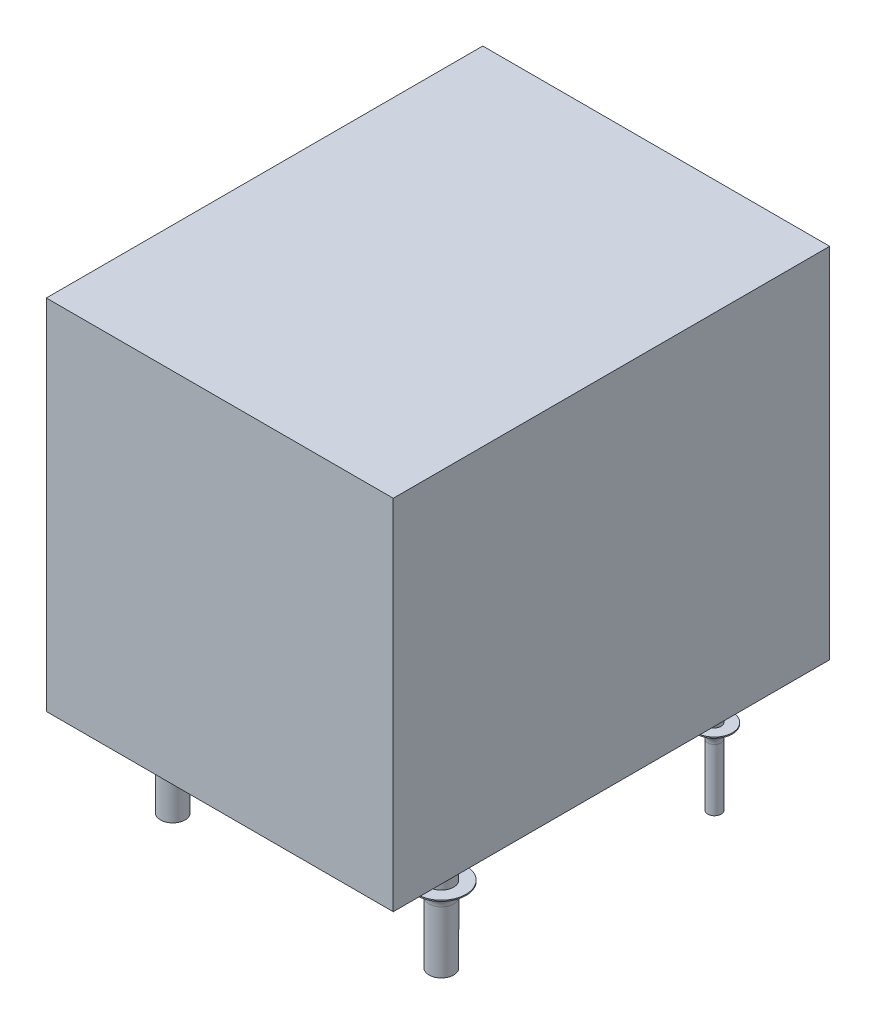
from build123d import *

# Parameters (mm, degrees)
ESQUISSE1_W        = 15.5
ESQUISSE1_H        = 19.5
BOSS_EXTRU_1_DEPTH = 16
ESQUISSE2_R        = 0.55
ESQUISSE2_R_2      = 0.3
BOSS_EXTRU_2_DEPTH = 5
BOSS_EXTRU_3_START = 1.6
ESQUISSE4_R        = 1.1
ESQUISSE4_R_2      = 0.8
BOSS_EXTRU_3_DEPTH = 0.05
CONG_1_R           = 0.6


with BuildPart() as part:
    # Esquisse1 → Boss.-Extru.1 (new body)
    with BuildSketch(Plane(origin=(0, 0, 0), x_dir=(1, 0, 0), z_dir=(0, 1, 0))):
        with Locations((7.75, 9.75)):
            Rectangle(ESQUISSE1_W, ESQUISSE1_H)
    extrude(amount=BOSS_EXTRU_1_DEPTH)

    # Esquisse2 → Boss.-Extru.2 (add)
    with BuildSketch(Plane.XZ):
        with Locations(Location((1.75, -3.9, 0), (0, 0, 270))):
            Circle(ESQUISSE2_R)
        with Locations(Location((13.75, -3.9, 0), (0, 0, 270))):
            Circle(ESQUISSE2_R)
        with Locations(Location((7.75, -18.1, 0), (0, 0, 270))):
            Circle(ESQUISSE2_R)
        with Locations(Location((1.75, -16.1, 0), (0, 0, 270))):
            Circle(ESQUISSE2_R_2)
        with Locations(Location((13.75, -16.1, 0), (0, 0, 270))):
            Circle(ESQUISSE2_R_2)
    extrude(amount=BOSS_EXTRU_2_DEPTH)

    # Esquisse4 → Boss.-Extru.3 (add)
    with BuildSketch(Plane.XZ.offset(BOSS_EXTRU_3_START)):
        with Locations(Location((1.75, -3.9, 0), (0, 0, 270))):
            Circle(ESQUISSE4_R)
        with Locations(Location((13.75, -3.9, 0), (0, 0, 270))):
            Circle(ESQUISSE4_R)
        with Locations(Location((7.75, -18.1, 0), (0, 0, 270))):
            Circle(ESQUISSE4_R)
        with Locations(Location((1.75, -16.1, 0), (0, 0, 270))):
            Circle(ESQUISSE4_R_2)
        with Locations(Location((13.75, -16.1, 0), (0, 0, 270))):
            Circle(ESQUISSE4_R_2)
    extrude(amount=BOSS_EXTRU_3_DEPTH)

    # Congé1
    # the kernel refuses this fillet: 0.6 mm, written as the material it adds along each edge
    with BuildSketch(Plane(origin=(1.75, -1.65, -3.9), x_dir=(0, 0, -1), z_dir=(1, 0, 0))) as cong_1_piece_1:
        with BuildLine():
            CenterArc((1.15, -0.597913037), CONG_1_R, 94.780191847, 85.219808153)
            Line((0.55, -0.597913037), (0.538, -0.597913037))
            Line((0.538, -0.597913037), (0.538, 0))
            Line((0.538, 0), (0.55, 0.012))
            ThreePointArc((0.55, 0.012), (0.825, 0.012), (1.099, 0.011958261))
            Line((1.099, 0.011958261), (1.1, 0))
        make_face()
    revolve(axis=Axis((1.75, -1.65, -3.9), (0, 1, 0)))
    with BuildSketch(Plane(origin=(13.75, -1.65, -3.9), x_dir=(0, 0, -1), z_dir=(1, 0, 0))) as cong_1_piece_2:
        with BuildLine():
            CenterArc((1.15, -0.597913037), CONG_1_R, 94.780191847, 85.219808153)
            Line((0.55, -0.597913037), (0.538, -0.597913037))
            Line((0.538, -0.597913037), (0.538, 0))
            Line((0.538, 0), (0.55, 0.012))
            ThreePointArc((0.55, 0.012), (0.825, 0.012), (1.099, 0.011958261))
            Line((1.099, 0.011958261), (1.1, 0))
        make_face()
    revolve(axis=Axis((13.75, -1.65, -3.9), (0, 1, 0)))
    with BuildSketch(Plane(origin=(7.75, -1.65, -18.1), x_dir=(0, 0, -1), z_dir=(1, 0, 0))) as cong_1_piece_3:
        with BuildLine():
            CenterArc((1.15, -0.597913037), CONG_1_R, 94.780191847, 85.219808153)
            Line((0.55, -0.597913037), (0.538, -0.597913037))
            Line((0.538, -0.597913037), (0.538, 0))
            Line((0.538, 0), (0.55, 0.012))
            ThreePointArc((0.55, 0.012), (0.825, 0.012), (1.099, 0.011958261))
            Line((1.099, 0.011958261), (1.1, 0))
        make_face()
    revolve(axis=Axis((7.75, -1.65, -18.1), (0, 1, 0)))
    with BuildSketch(Plane(origin=(1.75, -1.65, -16.1), x_dir=(0, 0, -1), z_dir=(1, 0, 0))) as cong_1_piece_4:
        with BuildLine():
            CenterArc((0.9, -0.591607978), CONG_1_R, 99.594068227, 80.405931773)
            Line((0.3, -0.591607978), (0.288, -0.591607978))
            Line((0.288, -0.591607978), (0.288, 0))
            Line((0.288, 0), (0.3, 0.012))
            ThreePointArc((0.3, 0.012), (0.55, 0.012), (0.798, 0.01183216))
            Line((0.798, 0.01183216), (0.8, 0))
        make_face()
    revolve(axis=Axis((1.75, -1.65, -16.1), (0, 1, 0)))
    with BuildSketch(Plane(origin=(13.75, -1.65, -16.1), x_dir=(0, 0, -1), z_dir=(1, 0, 0))) as cong_1_piece_5:
        with BuildLine():
            CenterArc((0.9, -0.591607978), CONG_1_R, 99.594068227, 80.405931773)
            Line((0.3, -0.591607978), (0.288, -0.591607978))
            Line((0.288, -0.591607978), (0.288, 0))
            Line((0.288, 0), (0.3, 0.012))
            ThreePointArc((0.3, 0.012), (0.55, 0.012), (0.798, 0.01183216))
            Line((0.798, 0.01183216), (0.8, 0))
        make_face()
    revolve(axis=Axis((13.75, -1.65, -16.1), (0, 1, 0)))


solid = part.part
